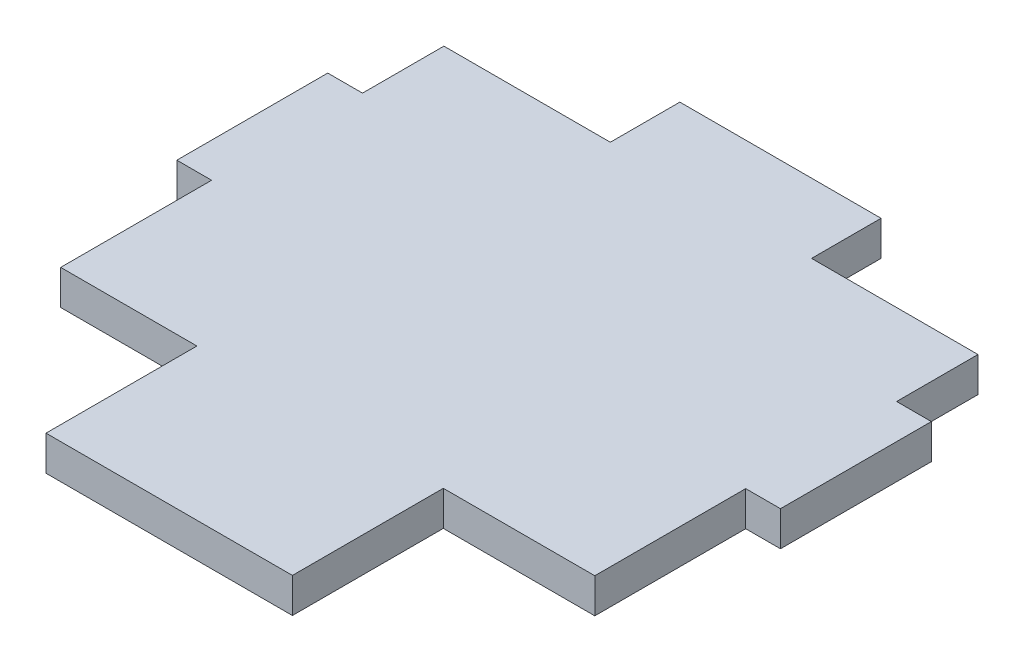
from build123d import *

# Parameters (mm, degrees)
SKETCH1_W           = 101.6
SKETCH1_H           = 76.2
BOSS_EXTRUDE1_DEPTH = 5.85
SKETCH2_W           = 41.475447085
SKETCH2_H           = 25.4
BOSS_EXTRUDE2_DEPTH = 5.85
CAVITY1_START       = -38.1
CAVITY1_OUTLINE_W   = 33.866666667
CAVITY1_OUTLINE_H   = 5.85
CAVITY1_DEPTH       = 11.7
CAVITY1_START_2     = 12.7
CAVITY1_2_OUTLINE_W = 5.85
CAVITY1_2_OUTLINE_H = 5.85
CAVITY1_2_DEPTH     = 25.4
CAVITY1_START_3     = -26.4
CAVITY1_3_OUTLINE_W = 5.85
CAVITY1_3_OUTLINE_H = 5.85
CAVITY1_3_DEPTH     = 13.7


# Read off the part's stored shape, not the designer's step: Cavity1
with BuildPart() as part:
    # Sketch1 → Boss-Extrude1 (new body)
    with BuildSketch(Plane(origin=(0, 0, 0), x_dir=(1, 0, 0), z_dir=(0, 1, 0))):
        Rectangle(SKETCH1_W, SKETCH1_H)
    extrude(amount=BOSS_EXTRUDE1_DEPTH)

    # Sketch2 → Boss-Extrude2 (add)
    with BuildSketch(Plane(origin=(0, 5.85, 0), x_dir=(1, 0, 0), z_dir=(0, 1, 0))):
        with Locations((-1.285396087, -50.8)):
            Rectangle(SKETCH2_W, SKETCH2_H)
    extrude(amount=-BOSS_EXTRUDE2_DEPTH)

    # Cavity1 outline → Cavity1 (cut)
    with BuildSketch(Plane.XY.offset(CAVITY1_START)):
        with Locations((33.866666667, 2.925)):
            Rectangle(CAVITY1_OUTLINE_W, CAVITY1_OUTLINE_H)
        with Locations((-33.866666667, 2.925)):
            Rectangle(CAVITY1_OUTLINE_W, CAVITY1_OUTLINE_H)
    extrude(amount=CAVITY1_DEPTH, mode=Mode.SUBTRACT)

    # Cavity1 2 outline → Cavity1 2 (cut)
    with BuildSketch(Plane.XY.offset(CAVITY1_START_2)):
        with Locations((47.875, 2.925)):
            Rectangle(CAVITY1_2_OUTLINE_W, CAVITY1_2_OUTLINE_H)
        with Locations((-47.875, 2.925)):
            Rectangle(CAVITY1_2_OUTLINE_W, CAVITY1_2_OUTLINE_H)
    extrude(amount=CAVITY1_2_DEPTH, mode=Mode.SUBTRACT)

    # Cavity1 3 outline → Cavity1 3 (cut)
    with BuildSketch(Plane.XY.offset(CAVITY1_START_3)):
        with Locations((47.875, 2.925)):
            Rectangle(CAVITY1_3_OUTLINE_W, CAVITY1_3_OUTLINE_H)
        with Locations((-47.875, 2.925)):
            Rectangle(CAVITY1_3_OUTLINE_W, CAVITY1_3_OUTLINE_H)
    extrude(amount=CAVITY1_3_DEPTH, mode=Mode.SUBTRACT)


solid = part.part
